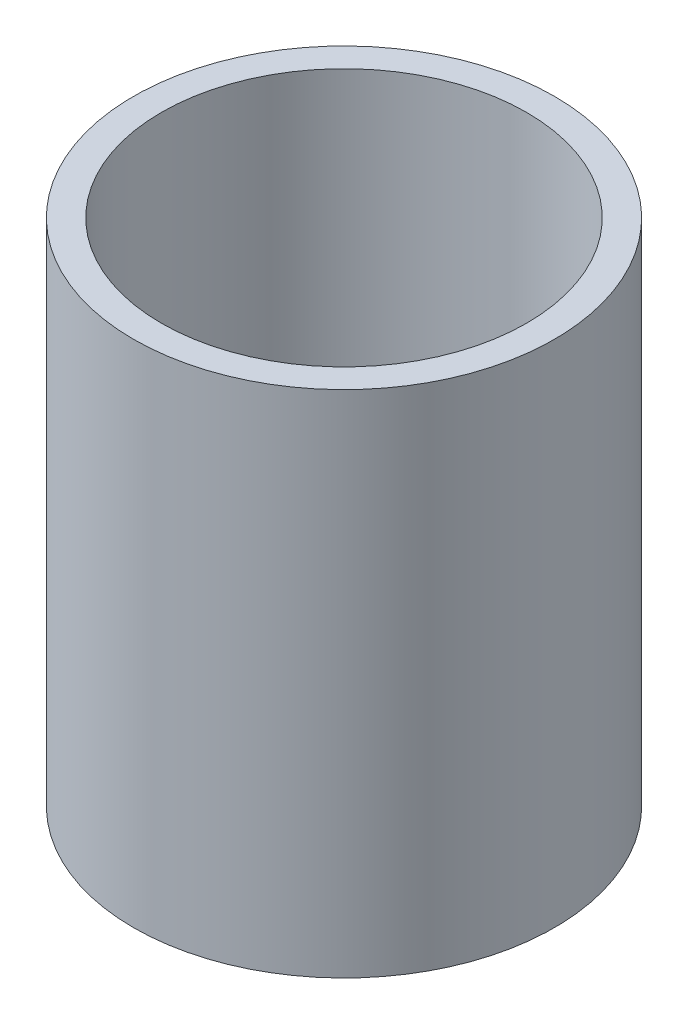
from build123d import *

# Parameters (mm, degrees)
SKETCH1_R           = 45
BOSS_EXTRUDE1_DEPTH = 108.952865677
SKETCH2_R           = 39.049895175
CUT_EXTRUDE1_DEPTH  = 127.177363022


with BuildPart() as part:
    # Sketch1 → Boss-Extrude1 (new body)
    with BuildSketch(Plane(origin=(0, 0, 0), x_dir=(1, 0, 0), z_dir=(0, 1, 0))):
        Circle(SKETCH1_R)
    extrude(amount=BOSS_EXTRUDE1_DEPTH)

    # Sketch2 → Cut-Extrude1 (cut, through all)
    with BuildSketch(Plane(origin=(0, 0, 0), x_dir=(1, 0, 0), z_dir=(0, 1, 0))):
        Circle(SKETCH2_R)
    extrude(amount=CUT_EXTRUDE1_DEPTH, mode=Mode.SUBTRACT)


solid = part.part
